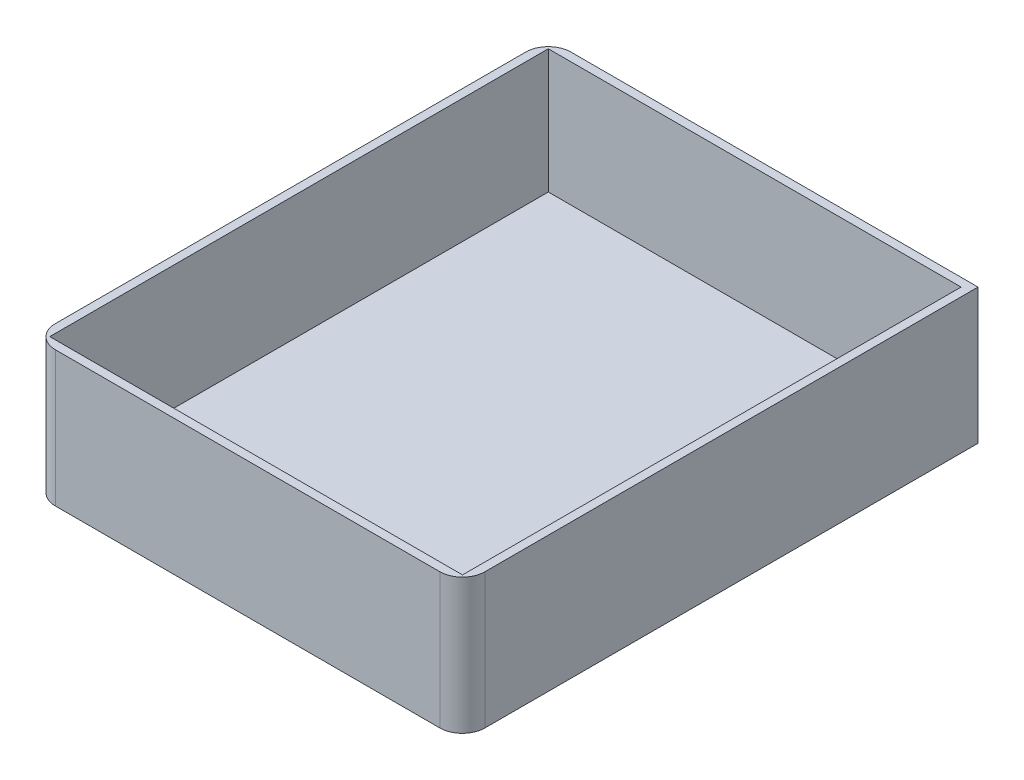
from build123d import *

# Parameters (mm, degrees)
SKETCH1_W           = 381
SKETCH1_H           = 457.2
SKETCH1_W_2         = 366
SKETCH1_H_2         = 442.1
BOSS_EXTRUDE1_DEPTH = 120
SKETCH2_W           = 366
SKETCH2_H           = 442.1
BOSS_EXTRUDE2_DEPTH = 10
FILLET1_R           = 20


with BuildPart() as part:
    # Sketch1 → Boss-Extrude1 (new body)
    with BuildSketch(Plane(origin=(0, 0, 0), x_dir=(1, 0, 0), z_dir=(0, 1, 0))):
        with Locations((190.5, 228.6)):
            Rectangle(SKETCH1_W, SKETCH1_H)
        with Locations((190.5, 228.65)):
            Rectangle(SKETCH1_W_2, SKETCH1_H_2, mode=Mode.SUBTRACT)
    extrude(amount=BOSS_EXTRUDE1_DEPTH)

    # Sketch2 → Boss-Extrude2 (add)
    with BuildSketch(Plane.XZ):
        with Locations((190.5, -228.65)):
            Rectangle(SKETCH2_W, SKETCH2_H)
    extrude(amount=-BOSS_EXTRUDE2_DEPTH)

    # Fillet1
    fillet1_edges = [part.edges().sort_by_distance(p)[0] for p in [
        (0, 60, 0),
        (0, 60, -457.2),
        (381, 60, 0),
    ]]
    fillet(fillet1_edges, radius=FILLET1_R)


solid = part.part
